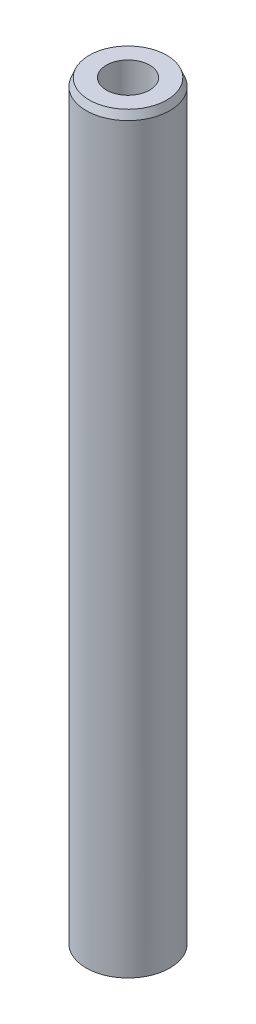
from build123d import *
from OCP.BRepFilletAPI import BRepFilletAPI_MakeChamfer

# Parameters (mm, degrees)
SKETCH1_R           = 17.5
BOSS_EXTRUDE1_DEPTH = 314.982312778
SKETCH2_R           = 9.053070271
CUT_EXTRUDE1_DEPTH  = 316.953093612
CHAMFER1_SIZE       = 3.202345399
CHAMFER1_SIZE2      = 1.28796308


with BuildPart() as part:
    # Sketch1 → Boss-Extrude1 (new body)
    with BuildSketch(Plane(origin=(0, 0, 0), x_dir=(1, 0, 0), z_dir=(0, 1, 0))):
        Circle(SKETCH1_R)
    extrude(amount=BOSS_EXTRUDE1_DEPTH)

    # Sketch2 → Cut-Extrude1 (cut, through all)
    with BuildSketch(Plane(origin=(0, 0, 0), x_dir=(1, 0, 0), z_dir=(0, 1, 0))):
        Circle(SKETCH2_R)
    extrude(amount=CUT_EXTRUDE1_DEPTH, mode=Mode.SUBTRACT)

    # Chamfer1: one chamfer whose edges measure the first distance from different faces: ONE call of the kernel's chamfer builder (chamfer() names one face for all edges)
    chamfer1_edges_1 = [part.edges().sort_by_distance(p)[0] for p in [
        (-17.5, 314.982312778, 0),
    ]]
    chamfer1_side_1 = [part.faces().sort_by_distance(p)[0] for p in [
        (-17.5, 157.491156389, 0),
    ]]
    chamfer1_edges_2 = [part.edges().sort_by_distance(p)[0] for p in [
        (-17.5, 0, 0),
    ]]
    chamfer1_side_2 = [part.faces().sort_by_distance(p)[0] for p in [
        (-17.005025253, 0, 0),
    ]]
    chamfer1 = BRepFilletAPI_MakeChamfer(part.part.solid().wrapped)
    for e in chamfer1_edges_1:
        chamfer1.Add(CHAMFER1_SIZE, CHAMFER1_SIZE2, e.wrapped, chamfer1_side_1[0].wrapped)  # the first distance lies on this face
    for e in chamfer1_edges_2:
        chamfer1.Add(CHAMFER1_SIZE, CHAMFER1_SIZE2, e.wrapped, chamfer1_side_2[0].wrapped)  # the first distance lies on this face
    add(Compound.cast(chamfer1.Shape()), mode=Mode.REPLACE)


solid = part.part
